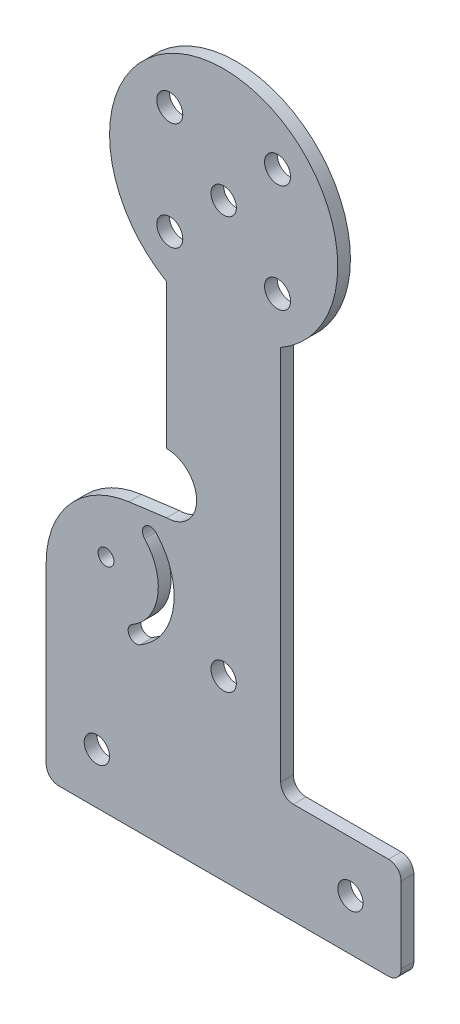
from build123d import *

# Parameters (mm, degrees)
SKETCH_1_R      = 2
SKETCH_1_R_2    = 2.05
SKETCH_1_R_3    = 1.25
EXTRUDE_1_DEPTH = 2
FILLET_1_R      = 2
FILLET_2_R      = 15


with BuildPart() as part:
    # 草图1 → 凸台-拉伸1 (new body)
    with BuildSketch(Plane.XY):
        with BuildLine():
            Line((14.659550972, 15.317683161), (14.659550972, 31.317683161))
            Line((14.659550972, 31.317683161), (-4.340449028, 31.317683161))
            Line((-4.340449028, 31.317683161), (-4.340449028, 92.729225893))
            ThreePointArc((-4.340449028, 92.729225893), (-13.340449028, 126.317683161), (-22.340449028, 92.729225893))
            Line((-22.340449028, 92.729225893), (-22.340449028, 69.922171604))
            ThreePointArc((-22.340449028, 69.922171604), (-17.60762504, 65.189347616), (-22.340449028, 60.456523627))
            Line((-22.340449028, 60.456523627), (-41.340449028, 57.95593233))
            Line((-41.340449028, 57.95593233), (-41.340449028, 31.317683161))
            Line((-41.340449028, 31.317683161), (-41.340449028, 15.317683161))
            Line((-41.340449028, 15.317683161), (14.659550972, 15.317683161))
        make_face()
        with Locations((-33.340449028, 23.317683161)):
            Circle(SKETCH_1_R, mode=Mode.SUBTRACT)
        with Locations((6.659550972, 23.317683161)):
            Circle(SKETCH_1_R, mode=Mode.SUBTRACT)
        with Locations((-13.340449028, 108.317683161)):
            Circle(SKETCH_1_R, mode=Mode.SUBTRACT)
        with Locations((-13.340449028, 43.317683161)):
            Circle(SKETCH_1_R, mode=Mode.SUBTRACT)
        with Locations((-4.840449028, 116.817683161)):
            Circle(SKETCH_1_R_2, mode=Mode.SUBTRACT)
        with Locations((-31.902307309, 50.317683161)):
            Circle(SKETCH_1_R_3, mode=Mode.SUBTRACT)
        with Locations((-4.840449028, 99.817683161)):
            Circle(SKETCH_1_R_2, mode=Mode.SUBTRACT)
        with Locations((-21.840449028, 99.817683161)):
            Circle(SKETCH_1_R_2, mode=Mode.SUBTRACT)
        with Locations((-21.840449028, 116.817683161)):
            Circle(SKETCH_1_R_2, mode=Mode.SUBTRACT)
        with BuildLine():
            ThreePointArc((-26.536162252, 41.002803279), (-21.278560655, 48.674969847), (-23.973383464, 57.576792381))
            ThreePointArc((-23.973383464, 57.576792381), (-25.73943382, 57.654677802), (-25.817319241, 55.888627446))
            ThreePointArc((-25.817319241, 55.888627446), (-23.749199411, 49.056996199), (-27.784102963, 43.169054414))
            ThreePointArc((-27.784102963, 43.169054414), (-28.243258175, 41.461958491), (-26.536162252, 41.002803279))
        make_face(mode=Mode.SUBTRACT)
    extrude(amount=EXTRUDE_1_DEPTH)

    # 圆角1
    fillet_1_edges = [part.edges().sort_by_distance(p)[0] for p in [
        (14.659550972, 31.317683161, 1),
        (14.659550972, 15.317683161, 1),
        (-41.340449028, 15.317683161, 1),
        (-4.340449028, 31.317683161, 1),
    ]]
    fillet(fillet_1_edges, radius=FILLET_1_R)

    # 圆角2
    fillet_2_edges = [part.edges().sort_by_distance(p)[0] for p in [
        (-41.340449028, 57.95593233, 1),
    ]]
    fillet(fillet_2_edges, radius=FILLET_2_R)


solid = part.part
